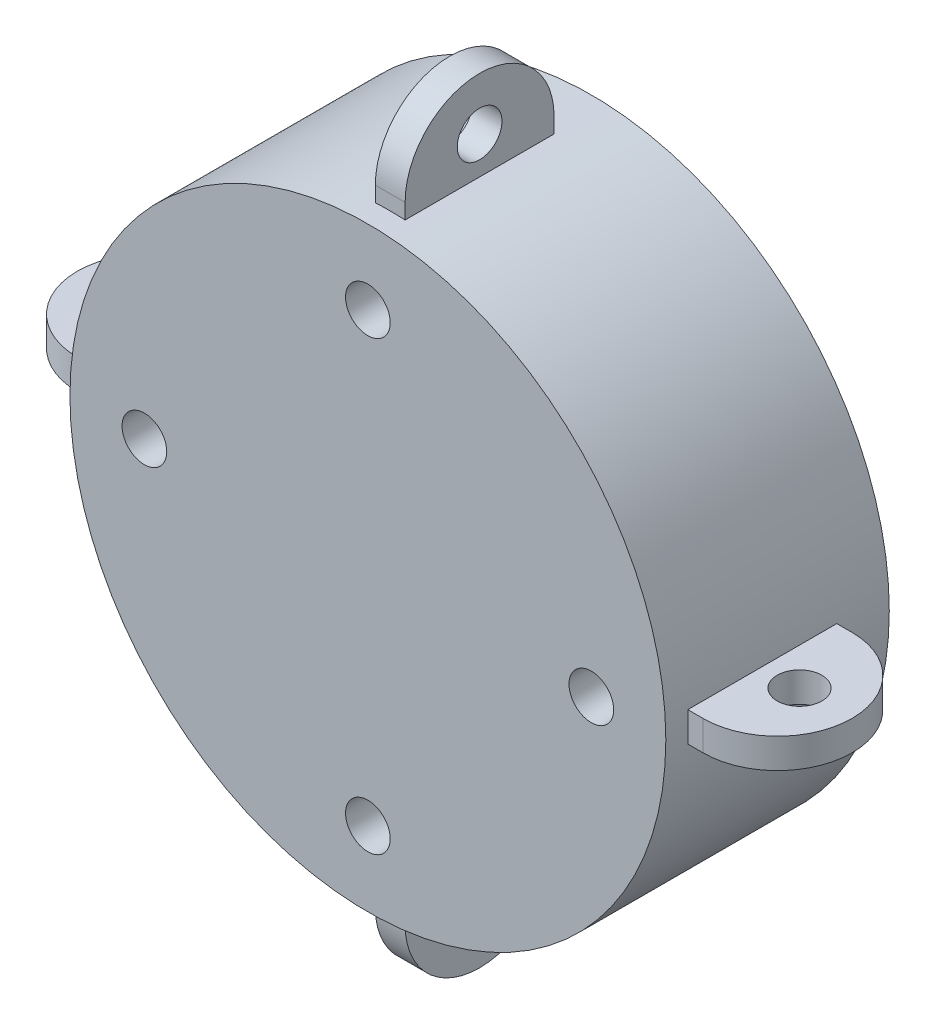
from build123d import *

# Parameters (mm, degrees)
SKETCH_1_R               = 40
EXTRUDE_1_DEPTH          = 30
SKETCH_2_R               = 3
CUT_EXTRUDE_1_DEPTH      = 65.031242374
EXTRUDE_2_DEPTH          = 2
SKETCH_4_R               = 3
CUT_EXTRUDE_2_DEPTH      = 74.266636336
PATTERN_CIRCULAR_2_COUNT = 4


with BuildPart() as part:
    # 草图1 → 凸台-拉伸1 (new body)
    with BuildSketch(Plane.XY):
        Circle(SKETCH_1_R)
    extrude(amount=EXTRUDE_1_DEPTH)

    # 草图2 → 切除-拉伸1 (cut, through all)
    with BuildSketch(Plane.XY.offset(30)):
        with Locations((30, 0)):
            Circle(SKETCH_2_R)
        with Locations((0, 30)):
            Circle(SKETCH_2_R)
        with Locations((-30, 0)):
            Circle(SKETCH_2_R)
        with Locations((0, -30)):
            Circle(SKETCH_2_R)
    extrude(amount=-CUT_EXTRUDE_1_DEPTH, mode=Mode.SUBTRACT)

    # 草图3 → 凸台-拉伸2 (add, symmetric)
    with BuildSketch(Plane(origin=(0, 0, 0), x_dir=(0, 0, -1), z_dir=(1, 0, 0))):
        with BuildLine():
            Line((-7, 38), (-27, 38))
            Line((-27, 38), (-27, 42))
            ThreePointArc((-27, 42), (-17, 52), (-7, 42))
            Line((-7, 42), (-7, 38))
        make_face()
    extrude_2 = extrude(amount=EXTRUDE_2_DEPTH, both=True)

    # 草图4 → 切除-拉伸2 (cut, through all)
    with BuildSketch(Plane(origin=(2, 0, 0), x_dir=(0, 0, -1), z_dir=(1, 0, 0))):
        with Locations((-17, 44.949968711)):
            Circle(SKETCH_4_R)
    cut_extrude_2 = extrude(amount=-CUT_EXTRUDE_2_DEPTH, mode=Mode.SUBTRACT)

    # 阵列(圆周)2: 凸台-拉伸2, 切除-拉伸2 ×4 about axis
    pattern_circular_2_axis = Axis((0, 0, 30), (0, 0, -1))
    add([extrude_2.rotate(pattern_circular_2_axis, i * 360 / PATTERN_CIRCULAR_2_COUNT) for i in range(1, PATTERN_CIRCULAR_2_COUNT)])
    add([cut_extrude_2.rotate(pattern_circular_2_axis, i * 360 / PATTERN_CIRCULAR_2_COUNT) for i in range(1, PATTERN_CIRCULAR_2_COUNT)], mode=Mode.SUBTRACT)


solid = part.part
